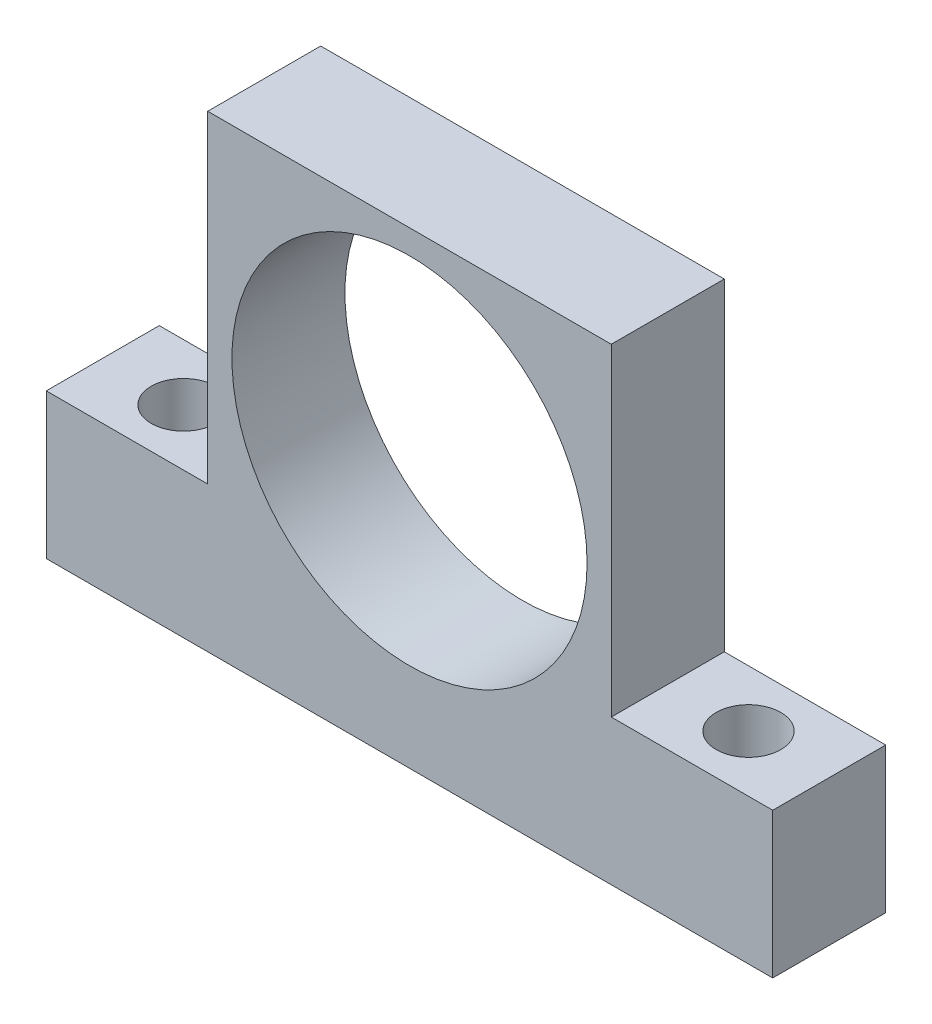
from build123d import *

# Parameters (mm, degrees)
SKETCH1_R           = 11
BOSS_EXTRUDE1_DEPTH = 7
SKETCH2_R           = 2
CUT_EXTRUDE1_DEPTH  = 7


with BuildPart() as part:
    # Sketch1 → Boss-Extrude1 (new body)
    with BuildSketch(Plane.XY):
        Polygon((12.5, 12.5), (-12.5, 12.5), (-12.5, -7.5), (-22.5, -7.5), (-22.5, -16.5), (22.5, -16.5), (22.5, -7.5), (12.5, -7.5), align=None)
        Circle(SKETCH1_R, mode=Mode.SUBTRACT)
    extrude(amount=BOSS_EXTRUDE1_DEPTH)

    # Sketch2 → Cut-Extrude1 (cut)
    with BuildSketch(Plane(origin=(0, -7.5, 0), x_dir=(1, 0, 0), z_dir=(0, 1, 0))):
        with Locations((-17.5, -3.5)):
            Circle(SKETCH2_R)
        with Locations((17.5, -3.5)):
            Circle(SKETCH2_R)
    extrude(amount=-CUT_EXTRUDE1_DEPTH, mode=Mode.SUBTRACT)


solid = part.part
